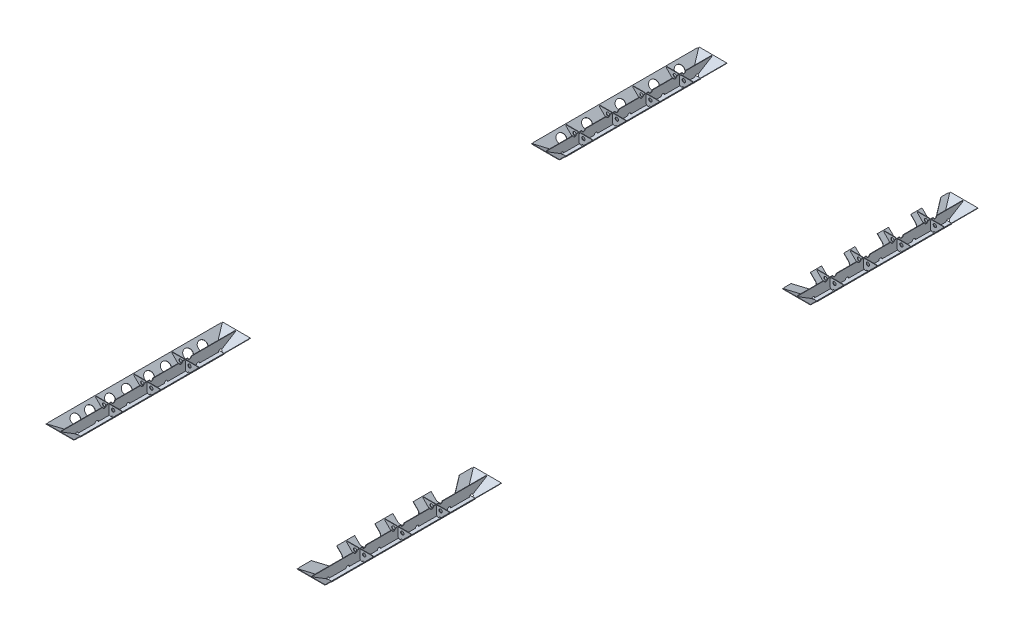
from build123d import *

# Parameters (mm, degrees)
EXTRUDE_1_DEPTH        = 3815
EXTRUDE_1_DEPTH_BACK   = 2635
EXTRUDE_1_2_DEPTH      = 3815
EXTRUDE_1_2_DEPTH_BACK = 2635
CUT_EXTRUDE_1_DEPTH    = 4017.351686101
EXTRUDE_2_DEPTH        = 3
EXTRUDE_3_DEPTH        = 3
EXTRUDE_4_DEPTH        = 3
EXTRUDE_5_DEPTH        = 3
SKETCH_9_W             = 70
SKETCH_9_H             = 1206.908239056
EXTRUDE_6_DEPTH        = 8
SKETCH_9_H_2           = 1286.908239056
EXTRUDE_6_2_DEPTH      = 8
CHAMFER_1_SIZE         = 10
CHAMFER_1_SIZE_2       = 7.139641905
CHAMFER_2_SIZE         = 10
CHAMFER_2_SIZE_2       = 7.139641905
CHAMFER_3_SIZE         = 10
CHAMFER_3_SIZE_2       = 7.139641905
CHAMFER_4_SIZE         = 10
CHAMFER_4_SIZE_2       = 7.139641905
EXTRUDE_7_DEPTH        = 2
EXTRUDE_7_DEPTH_BACK   = 2
EXTRUDE_8_DEPTH        = 2
EXTRUDE_8_DEPTH_BACK   = 2
EXTRUDE_START          = -2039
EXTRUDE_9_OUTLINE_R    = 15
EXTRUDE_9_DEPTH        = 4
PATTERN_LINEAR_1_COUNT = 4
PATTERN_LINEAR_1_PITCH = 300
SKETCH_14_R            = 15
EXTRUDE_10_DEPTH       = 4
PATTERN_LINEAR_2_COUNT = 2
PATTERN_LINEAR_2_PITCH = 343
PATTERN_LINEAR_3_COUNT = 2
PATTERN_LINEAR_3_PITCH = 342
SKETCH_15_R            = 40
CUT_EXTRUDE_2_DEPTH    = 3626.799052034
SKETCH_16_R            = 40
CUT_EXTRUDE_3_DEPTH    = 3626.799052034
CUT_EXTRUDE_4_DEPTH    = 3647.131196916
CUT_EXTRUDE_5_DEPTH    = 3647.131196916
CUT_EXTRUDE_6_DEPTH    = 3647.131196916
CUT_EXTRUDE_7_DEPTH    = 3647.131196916
CUT_EXTRUDE_8_DEPTH    = 4467.849280283
CUT_EXTRUDE_9_DEPTH    = 3974.987784466
CUT_EXTRUDE_10_DEPTH   = 3381.10603862
CUT_EXTRUDE_11_DEPTH   = 3865.510804019


# Read off the part's stored shape, not the designer's step: Бобышка-Вытянуть9
with BuildPart() as part:
    # Эскиз3 → Бобышка-Вытянуть1 (new, two sides: drawn at the far end of the back side and taken through both)
    with BuildSketch(Plane.XY.offset(-EXTRUDE_1_DEPTH_BACK)):
        Polygon((1000, -3), (1090, -93), (1087.878679656, -95.121320344), (997.878679656, -5.121320344), align=None)
    extrude(amount=EXTRUDE_1_DEPTH + EXTRUDE_1_DEPTH_BACK)


with BuildPart() as body_2:
    # Эскиз3 → Extrude 1 2 (new, two sides: drawn at the far end of the back side and taken through both)
    with BuildSketch(Plane.XY.offset(-EXTRUDE_1_2_DEPTH_BACK)):
        Polygon((1252.121320344, -5.121320344), (1162.121320344, -95.121320344), (1160, -93), (1250, -3), align=None)
    extrude(amount=EXTRUDE_1_2_DEPTH + EXTRUDE_1_2_DEPTH_BACK)


with BuildPart() as cut_extrude_1_tool:
    # Эскиз4 → Вырез-Вытянуть1 (new, through all)
    with BuildSketch(Plane(origin=(0, 0, 0), x_dir=(0, 0, -1), z_dir=(1, 0, 0))):
        Polygon((2335, -3), (2185, -95.121320344), (2635, -95.121320344), (2635, -3), align=None)
        Polygon((835, -3), (985, -95.121320344), (-2085, -95.121320344), (-1935, -3), align=None)
        Polygon((-3515, -3), (-3365, -95.121320344), (-3815, -95.121320344), (-3815, -3), align=None)
    extrude(amount=CUT_EXTRUDE_1_DEPTH)


with BuildPart() as part_1:
    add(part.part)

    # Вырез-Вытянуть1: cut by cut_extrude_1_tool
    add(cut_extrude_1_tool.part, mode=Mode.SUBTRACT)


with BuildPart() as body_2_1:
    add(body_2.part)

    # Вырез-Вытянуть1: cut by cut_extrude_1_tool
    add(cut_extrude_1_tool.part, mode=Mode.SUBTRACT)


with BuildPart() as cut_extrude_1_piece_1:
    # of the separate pieces the step leaves, piece 1, a body of its own (cut_extrude_1_pieces)
    add(part_1.part.solids().sort_by_distance((1000, -3, 1935))[0])

    # Фаска3
    # the kernel refuses this chamfer: 10, 7.139641905 mm, written as the material it takes off along each edge
    with BuildSketch(Plane(origin=(985.954478201, -17.045521799, 1957.870148431), x_dir=(0.5142163704539047, 0.5531014120676607, 0.655484822346004), z_dir=(0.4636730697913419, 0.4636730697928468, -0.754993091822138)), Plane(origin=(1011.924201456, 8.924201456, 3534.416028903), x_dir=(0.5142163704539051, 0.5531014120676603, -0.6554848223460039), z_dir=(-0.4636730697913419, -0.4636730697928468, -0.754993091822138))) as chamfer_3_piece_1:
        Polygon((CHAMFER_3_SIZE * 0.999621916911, CHAMFER_3_SIZE * 0.0274958766106), (CHAMFER_3_SIZE_2 * 0.580375479183, CHAMFER_3_SIZE_2 * 0.814349005757), (0, 0), align=None)
    extrude(amount=56.008694373, mode=Mode.SUBTRACT)

    # Эскиз19 → Вырез-Вытянуть6 (cut, through all)
    with BuildSketch(Plane(origin=(496.378679656, 496.378679656, 0), x_dir=(0, 0, 1), z_dir=(-0.7071067811865474, -0.7071067811865477, 0))):
        with BuildLine():
            Line((3353.454119528, -836.507322144), (3368.454119528, -836.507322144))
            Line((3368.454119528, -836.507322144), (3379.779015905, -826.671330987))
            ThreePointArc((3379.779015905, -826.671330987), (3363.204045512, -822.456104302), (3353.454119528, -836.507322144))
        make_face()
        with BuildLine():
            Line((2096.545880472, -836.507322144), (2081.545880472, -836.507322144))
            Line((2081.545880472, -836.507322144), (2070.220984095, -826.671330987))
            ThreePointArc((2070.220984095, -826.671330987), (2086.795954488, -822.456104302), (2096.545880472, -836.507322144))
        make_face()
        with BuildLine():
            Line((3091, -836.507322144), (3121, -836.507322144))
            ThreePointArc((3121, -836.507322144), (3106, -821.507322144), (3091, -836.507322144))
        make_face()
        with BuildLine():
            Line((3031, -836.507322144), (3061, -836.507322144))
            ThreePointArc((3061, -836.507322144), (3046, -821.507322144), (3031, -836.507322144))
        make_face()
        with BuildLine():
            Line((2689, -836.507322144), (2719, -836.507322144))
            ThreePointArc((2719, -836.507322144), (2704, -821.507322144), (2689, -836.507322144))
        make_face()
        with BuildLine():
            Line((2749, -836.507322144), (2779, -836.507322144))
            ThreePointArc((2779, -836.507322144), (2764, -821.507322144), (2749, -836.507322144))
        make_face()
        with BuildLine():
            Line((2406, -836.507322144), (2436, -836.507322144))
            ThreePointArc((2436, -836.507322144), (2421, -821.507322144), (2406, -836.507322144))
        make_face()
        with BuildLine():
            Line((2346, -836.507322144), (2376, -836.507322144))
            ThreePointArc((2376, -836.507322144), (2361, -821.507322144), (2346, -836.507322144))
        make_face()
    extrude(amount=-CUT_EXTRUDE_6_DEPTH, mode=Mode.SUBTRACT)

    # Эскиз20 → Вырез-Вытянуть7 (cut, through all)
    with BuildSketch(Plane(origin=(496.378679656, 496.378679656, 0), x_dir=(0, 0, 1), z_dir=(-0.7071067811865474, -0.7071067811865477, 0))):
        with BuildLine():
            Line((2060.455042549, -709.22810153), (2164.308584866, -799.427825203))
            ThreePointArc((2164.308584866, -799.427825203), (2176.537697243, -806.698015774), (2190.537894618, -809.22810153))
            Line((2190.537894618, -809.22810153), (2275, -809.22810153))
            ThreePointArc((2275, -809.22810153), (2303.284271247, -797.512372778), (2315, -769.22810153))
            Line((2315, -769.22810153), (2315, -709.22810153))
            Line((2315, -709.22810153), (2060.455042549, -709.22810153))
        make_face()
        with BuildLine():
            Line((3160, -709.22810153), (3160, -769.22810153))
            ThreePointArc((3160, -769.22810153), (3171.715728753, -797.512372778), (3200, -809.22810153))
            Line((3200, -809.22810153), (3259.462105382, -809.22810153))
            ThreePointArc((3259.462105382, -809.22810153), (3273.462302757, -806.698015774), (3285.691415134, -799.427825203))
            Line((3285.691415134, -799.427825203), (3389.544957451, -709.22810153))
            Line((3389.544957451, -709.22810153), (3160, -709.22810153))
        make_face()
        with BuildLine():
            Line((2475, -709.22810153), (2658, -709.22810153))
            Line((2658, -709.22810153), (2658, -769.22810153))
            ThreePointArc((2658, -769.22810153), (2646.284271247, -797.512372778), (2618, -809.22810153))
            Line((2618, -809.22810153), (2515, -809.22810153))
            ThreePointArc((2515, -809.22810153), (2486.715728753, -797.512372778), (2475, -769.22810153))
            Line((2475, -769.22810153), (2475, -709.22810153))
        make_face()
        with BuildLine():
            Line((2818, -709.22810153), (3000, -709.22810153))
            Line((3000, -709.22810153), (3000, -769.22810153))
            ThreePointArc((3000, -769.22810153), (2988.284271247, -797.512372778), (2960, -809.22810153))
            Line((2960, -809.22810153), (2858, -809.22810153))
            ThreePointArc((2858, -809.22810153), (2829.715728753, -797.512372778), (2818, -769.22810153))
            Line((2818, -769.22810153), (2818, -709.22810153))
        make_face()
    extrude(amount=-CUT_EXTRUDE_7_DEPTH, mode=Mode.SUBTRACT)


with BuildPart() as cut_extrude_1_piece_2:
    # of the separate pieces the step leaves, piece 2, a body of its own (cut_extrude_1_pieces)
    add(part_1.part.solids().sort_by_distance((1000, -3, -2335))[0])

    # Фаска1
    # the kernel refuses this chamfer: 10, 7.139641905 mm, written as the material it takes off along each edge
    with BuildSketch(Plane(origin=(1011.924201456, 8.924201456, -815.583971097), x_dir=(0.514216370453908, 0.5531014120676567, -0.6554848223460048), z_dir=(-0.4636730697913424, -0.46367306979284734, -0.7549930918221375))) as chamfer_1_piece_1:
        Polygon((CHAMFER_1_SIZE * 0.999621916911, CHAMFER_1_SIZE * 0.0274958766106), (CHAMFER_1_SIZE_2 * 0.580375479183, CHAMFER_1_SIZE_2 * 0.814349005757), (0, 0), align=None)
    extrude(amount=56.008694373, mode=Mode.SUBTRACT)
    with BuildSketch(Plane(origin=(1011.924201456, 8.924201456, -2354.416028903), x_dir=(0.5142163704539046, 0.5531014120676621, 0.6554848223460031), z_dir=(-0.4636730697913412, -0.46367306979284617, 0.7549930918221388))) as chamfer_1_piece_2:
        Polygon((CHAMFER_1_SIZE * 0.999621916911, -CHAMFER_1_SIZE * 0.0274958766106), (CHAMFER_1_SIZE_2 * 0.580375479183, -CHAMFER_1_SIZE_2 * 0.814349005757), (0, 0), align=None)
    extrude(amount=56.008694373, mode=Mode.SUBTRACT)

    # Эскиз17 → Вырез-Вытянуть4 (cut, through all)
    with BuildSketch(Plane(origin=(496.378679656, 496.378679656, 0), x_dir=(0, 0, 1), z_dir=(-0.7071067811865474, -0.7071067811865477, 0))):
        with BuildLine():
            Line((-996.545880472, -836.507322144), (-981.545880472, -836.507322144))
            Line((-981.545880472, -836.507322144), (-970.220984095, -826.671330987))
            ThreePointArc((-970.220984095, -826.671330987), (-986.795954488, -822.456104302), (-996.545880472, -836.507322144))
        make_face()
        with BuildLine():
            Line((-2173.454119528, -836.507322144), (-2188.454119528, -836.507322144))
            Line((-2188.454119528, -836.507322144), (-2199.779015905, -826.671330987))
            ThreePointArc((-2199.779015905, -826.671330987), (-2183.204045512, -822.456104302), (-2173.454119528, -836.507322144))
        make_face()
        with BuildLine():
            Line((-1124, -836.507322144), (-1094, -836.507322144))
            ThreePointArc((-1094, -836.507322144), (-1109, -821.507322144), (-1124, -836.507322144))
        make_face()
        with BuildLine():
            Line((-1184, -836.507322144), (-1154, -836.507322144))
            ThreePointArc((-1154, -836.507322144), (-1169, -821.507322144), (-1184, -836.507322144))
        make_face()
        with BuildLine():
            Line((-1484, -836.507322144), (-1454, -836.507322144))
            ThreePointArc((-1454, -836.507322144), (-1469, -821.507322144), (-1484, -836.507322144))
        make_face()
        with BuildLine():
            Line((-1424, -836.507322144), (-1394, -836.507322144))
            ThreePointArc((-1394, -836.507322144), (-1409, -821.507322144), (-1424, -836.507322144))
        make_face()
        with BuildLine():
            Line((-1724, -836.507322144), (-1694, -836.507322144))
            ThreePointArc((-1694, -836.507322144), (-1709, -821.507322144), (-1724, -836.507322144))
        make_face()
        with BuildLine():
            Line((-1784, -836.507322144), (-1754, -836.507322144))
            ThreePointArc((-1754, -836.507322144), (-1769, -821.507322144), (-1784, -836.507322144))
        make_face()
        with BuildLine():
            Line((-2024, -836.507322144), (-1994, -836.507322144))
            ThreePointArc((-1994, -836.507322144), (-2009, -821.507322144), (-2024, -836.507322144))
        make_face()
        with BuildLine():
            Line((-2084, -836.507322144), (-2054, -836.507322144))
            ThreePointArc((-2054, -836.507322144), (-2069, -821.507322144), (-2084, -836.507322144))
        make_face()
    extrude(amount=-CUT_EXTRUDE_4_DEPTH, mode=Mode.SUBTRACT)

    # Эскиз18 → Вырез-Вытянуть5 (cut, through all)
    with BuildSketch(Plane(origin=(496.378679656, 496.378679656, 0), x_dir=(0, 0, 1), z_dir=(-0.7071067811865474, -0.7071067811865477, 0))):
        with BuildLine():
            Line((-911.250576888, -709.22810153), (-1018.770690248, -802.612345322))
            ThreePointArc((-1018.770690248, -802.612345322), (-1061.595595951, -808.807486603), (-1085, -772.412621649))
            Line((-1085, -772.412621649), (-1085, -709.22810153))
            Line((-1085, -709.22810153), (-911.250576888, -709.22810153))
        make_face()
        with BuildLine():
            Line((-1385, -709.22810153), (-1185, -709.22810153))
            Line((-1185, -709.22810153), (-1185, -769.22810153))
            ThreePointArc((-1185, -769.22810153), (-1196.715728753, -797.512372778), (-1225, -809.22810153))
            Line((-1225, -809.22810153), (-1345, -809.22810153))
            ThreePointArc((-1345, -809.22810153), (-1373.284271247, -797.512372778), (-1385, -769.22810153))
            Line((-1385, -769.22810153), (-1385, -709.22810153))
        make_face()
        with BuildLine():
            Line((-1685, -709.22810153), (-1485, -709.22810153))
            Line((-1485, -709.22810153), (-1485, -769.22810153))
            ThreePointArc((-1485, -769.22810153), (-1496.715728753, -797.512372778), (-1525, -809.22810153))
            Line((-1525, -809.22810153), (-1645, -809.22810153))
            ThreePointArc((-1645, -809.22810153), (-1673.284271247, -797.512372778), (-1685, -769.22810153))
            Line((-1685, -769.22810153), (-1685, -709.22810153))
        make_face()
        with BuildLine():
            Line((-1985, -709.22810153), (-1785, -709.22810153))
            Line((-1785, -709.22810153), (-1785, -769.22810153))
            ThreePointArc((-1785, -769.22810153), (-1796.715728753, -797.512372778), (-1825, -809.22810153))
            Line((-1825, -809.22810153), (-1945, -809.22810153))
            ThreePointArc((-1945, -809.22810153), (-1973.284271247, -797.512372778), (-1985, -769.22810153))
            Line((-1985, -769.22810153), (-1985, -709.22810153))
        make_face()
        with BuildLine():
            Line((-2085, -709.22810153), (-2085, -769.412621649))
            ThreePointArc((-2085, -769.412621649), (-2108.404404049, -805.807486603), (-2151.229309752, -799.612345322))
            Line((-2151.229309752, -799.612345322), (-2255.295303584, -709.22810153))
            Line((-2255.295303584, -709.22810153), (-2085, -709.22810153))
        make_face()
    extrude(amount=-CUT_EXTRUDE_5_DEPTH, mode=Mode.SUBTRACT)


with BuildPart() as cut_extrude_1_piece_1_of_body_2:
    # of the separate pieces the step leaves, piece 1, a body of its own (cut_extrude_1_pieces_of_body_2)
    add(body_2_1.part.solids().sort_by_distance((1252.121320344, -5.121320344, 1938.454119528))[0])

    # Фаска4
    # the kernel refuses this chamfer: 10, 7.139641905 mm, written as the material it takes off along each edge
    with BuildSketch(Plane(origin=(1238.075798544, 8.924201456, 1915.583971097), x_dir=(-0.5142163704539027, 0.5531014120676626, 0.6554848223460039), z_dir=(0.4636730697913419, -0.4636730697928468, 0.754993091822138)), Plane(origin=(1264.045521799, -17.045521799, 3492.129851569), x_dir=(-0.5142163704539026, 0.5531014120676628, -0.6554848223460039), z_dir=(-0.4636730697913419, 0.4636730697928468, 0.754993091822138))) as chamfer_4_piece_1:
        Polygon((CHAMFER_4_SIZE * 0.999621916911, CHAMFER_4_SIZE * 0.0274958766106), (CHAMFER_4_SIZE_2 * 0.580375479183, CHAMFER_4_SIZE_2 * 0.814349005757), (0, 0), align=None)
    extrude(amount=56.008694373, mode=Mode.SUBTRACT)

    # Эскиз16 → Вырез-Вытянуть3 (cut, through all)
    with BuildSketch(Plane(origin=(628.621320344, -628.621320344, 0), x_dir=(0, 0, -1), z_dir=(0.7071067811865474, -0.7071067811865477, 0))):
        with Locations(Location((-2160, 814.482935526, 0), (0, 0, 90))):
            Circle(SKETCH_16_R)
        with Locations(Location((-2290, 814.482935526, 0), (0, 0, 90))):
            Circle(SKETCH_16_R)
        with Locations(Location((-2490, 814.482935526, 0), (0, 0, 90))):
            Circle(SKETCH_16_R)
        with Locations(Location((-2640, 814.482935526, 0), (0, 0, 90))):
            Circle(SKETCH_16_R)
        with Locations(Location((-2840, 814.482935526, 0), (0, 0, 90))):
            Circle(SKETCH_16_R)
        with Locations(Location((-2990, 814.482935526, 0), (0, 0, 90))):
            Circle(SKETCH_16_R)
        with Locations(Location((-3170, 814.482935526, 0), (0, 0, 90))):
            Circle(SKETCH_16_R)
        with Locations(Location((-3300, 814.482935526, 0), (0, 0, 90))):
            Circle(SKETCH_16_R)
        with BuildLine():
            Line((-2096.545880472, 754.482935526), (-2081.545880472, 754.482935526))
            Line((-2081.545880472, 754.482935526), (-2070.220984095, 764.318926683))
            ThreePointArc((-2070.220984095, 764.318926683), (-2086.795954488, 768.534153368), (-2096.545880472, 754.482935526))
        make_face()
        with BuildLine():
            Line((-3353.454119528, 754.482935526), (-3368.454119528, 754.482935526))
            Line((-3368.454119528, 754.482935526), (-3379.779015905, 764.318926683))
            ThreePointArc((-3379.779015905, 764.318926683), (-3363.204045512, 768.534153368), (-3353.454119528, 754.482935526))
        make_face()
        with BuildLine():
            Line((-2380, 754.482935526), (-2350, 754.482935526))
            ThreePointArc((-2350, 754.482935526), (-2365, 769.482935526), (-2380, 754.482935526))
        make_face()
        with BuildLine():
            Line((-2410, 754.482935526), (-2440, 754.482935526))
            ThreePointArc((-2440, 754.482935526), (-2425, 769.482935526), (-2410, 754.482935526))
        make_face()
        with BuildLine():
            Line((-2723, 754.482935526), (-2693, 754.482935526))
            ThreePointArc((-2693, 754.482935526), (-2708, 769.482935526), (-2723, 754.482935526))
        make_face()
        with BuildLine():
            Line((-2753, 754.482935526), (-2783, 754.482935526))
            ThreePointArc((-2783, 754.482935526), (-2768, 769.482935526), (-2753, 754.482935526))
        make_face()
        with BuildLine():
            Line((-3065, 754.482935526), (-3035, 754.482935526))
            ThreePointArc((-3035, 754.482935526), (-3050, 769.482935526), (-3065, 754.482935526))
        make_face()
        with BuildLine():
            Line((-3095, 754.482935526), (-3125, 754.482935526))
            ThreePointArc((-3125, 754.482935526), (-3110, 769.482935526), (-3095, 754.482935526))
        make_face()
    extrude(amount=-CUT_EXTRUDE_3_DEPTH, mode=Mode.SUBTRACT)


with BuildPart() as cut_extrude_1_piece_2_of_body_2:
    # of the separate pieces the step leaves, piece 2, a body of its own (cut_extrude_1_pieces_of_body_2)
    add(body_2_1.part.solids().sort_by_distance((1252.121320344, -5.121320344, -2331.545880472))[0])

    # Фаска2
    # the kernel refuses this chamfer: 10, 7.139641905 mm, written as the material it takes off along each edge
    with BuildSketch(Plane(origin=(1264.045521799, -17.045521799, -857.870148431), x_dir=(-0.5142163704539056, 0.5531014120676591, -0.6554848223460047), z_dir=(-0.4636730697913424, 0.46367306979284734, 0.7549930918221375))) as chamfer_2_piece_1:
        Polygon((CHAMFER_2_SIZE * 0.999621916911, CHAMFER_2_SIZE * 0.0274958766106), (CHAMFER_2_SIZE_2 * 0.580375479183, CHAMFER_2_SIZE_2 * 0.814349005757), (0, 0), align=None)
    extrude(amount=56.008694373, mode=Mode.SUBTRACT)
    with BuildSketch(Plane(origin=(1264.045521799, -17.045521799, -2312.129851569), x_dir=(-0.5142163704539028, 0.5531014120676637, 0.655484822346003), z_dir=(-0.4636730697913412, 0.46367306979284617, -0.7549930918221388))) as chamfer_2_piece_2:
        Polygon((CHAMFER_2_SIZE * 0.999621916911, -CHAMFER_2_SIZE * 0.0274958766106), (CHAMFER_2_SIZE_2 * 0.580375479183, -CHAMFER_2_SIZE_2 * 0.814349005757), (0, 0), align=None)
    extrude(amount=56.008694373, mode=Mode.SUBTRACT)

    # Эскиз15 → Вырез-Вытянуть2 (cut, through all)
    with BuildSketch(Plane(origin=(628.621320344, -628.621320344, 0), x_dir=(0, 0, -1), z_dir=(0.7071067811865474, -0.7071067811865477, 0))):
        with Locations(Location((2115, 814.482935526, 0), (0, 0, 90))):
            Circle(SKETCH_15_R)
        with Locations(Location((1885, 814.482935526, 0), (0, 0, 90))):
            Circle(SKETCH_15_R)
        with Locations(Location((1585, 814.482935526, 0), (0, 0, 90))):
            Circle(SKETCH_15_R)
        with Locations(Location((1285, 814.482935526, 0), (0, 0, 90))):
            Circle(SKETCH_15_R)
        with Locations(Location((1055, 814.482935526, 0), (0, 0, 90))):
            Circle(SKETCH_15_R)
        with BuildLine():
            Line((2173.454119528, 754.482935526), (2188.454119528, 754.482935526))
            Line((2188.454119528, 754.482935526), (2199.779015905, 764.318926683))
            ThreePointArc((2199.779015905, 764.318926683), (2183.204045512, 768.534153368), (2173.454119528, 754.482935526))
        make_face()
        with BuildLine():
            Line((2050, 754.482935526), (2080, 754.482935526))
            ThreePointArc((2080, 754.482935526), (2065, 769.482935526), (2050, 754.482935526))
        make_face()
        with BuildLine():
            Line((1990, 754.482935526), (2020, 754.482935526))
            ThreePointArc((2020, 754.482935526), (2005, 769.482935526), (1990, 754.482935526))
        make_face()
        with BuildLine():
            Line((1750, 754.482935526), (1780, 754.482935526))
            ThreePointArc((1780, 754.482935526), (1765, 769.482935526), (1750, 754.482935526))
        make_face()
        with BuildLine():
            Line((1690, 754.482935526), (1720, 754.482935526))
            ThreePointArc((1720, 754.482935526), (1705, 769.482935526), (1690, 754.482935526))
        make_face()
        with BuildLine():
            Line((1450, 754.482935526), (1480, 754.482935526))
            ThreePointArc((1480, 754.482935526), (1465, 769.482935526), (1450, 754.482935526))
        make_face()
        with BuildLine():
            Line((1390, 754.482935526), (1420, 754.482935526))
            ThreePointArc((1420, 754.482935526), (1405, 769.482935526), (1390, 754.482935526))
        make_face()
        with BuildLine():
            Line((1150, 754.482935526), (1180, 754.482935526))
            ThreePointArc((1180, 754.482935526), (1165, 769.482935526), (1150, 754.482935526))
        make_face()
        with BuildLine():
            Line((1090, 754.482935526), (1120, 754.482935526))
            ThreePointArc((1120, 754.482935526), (1105, 769.482935526), (1090, 754.482935526))
        make_face()
        with BuildLine():
            Line((996.545880472, 754.482935526), (981.545880472, 754.482935526))
            Line((981.545880472, 754.482935526), (970.220984095, 764.318926683))
            ThreePointArc((970.220984095, 764.318926683), (986.795954488, 768.534153368), (996.545880472, 754.482935526))
        make_face()
    extrude(amount=-CUT_EXTRUDE_2_DEPTH, mode=Mode.SUBTRACT)


with BuildPart() as body_5:
    # Эскиз5 → Бобышка-Вытянуть2 (new body)
    with BuildSketch(Plane(origin=(0, -1043.459630602, -640.832525975), x_dir=(1, 0, 0), z_dir=(0, 0.8521305478013935, 0.5233292744570068))):
        Polygon((1000, 1988.154841293), (1090, 1816.178985187), (1160, 1816.178985187), (1250, 1988.154841293), align=None)
    extrude(amount=-EXTRUDE_2_DEPTH)

    # Эскиз21 → Вырез-Вытянуть8 (cut, through all)
    with BuildSketch(Plane(origin=(0, -1046.016022245, -642.402513798), x_dir=(1, 0, 0), z_dir=(0, -0.8521305478013941, -0.5233292744570057))):
        with BuildLine():
            Line((1140, -1816.178985187), (1110, -1816.178985187))
            ThreePointArc((1110, -1816.178985187), (1125, -1831.178985187), (1140, -1816.178985187))
        make_face()
    extrude(amount=-CUT_EXTRUDE_8_DEPTH, mode=Mode.SUBTRACT)


with BuildPart() as body_6:
    # Эскиз6 → Бобышка-Вытянуть3 (new body)
    with BuildSketch(Plane(origin=(0, 370.185579794, -227.346562552), x_dir=(-1, 0, 0), z_dir=(1.9592936018679194e-15, -0.8521305478013921, 0.5233292744570088))):
        Polygon((-1090, 885.074851343), (-1000, 713.098995238), (-1250, 713.098995238), (-1160, 885.074851343), align=None)
    extrude(amount=EXTRUDE_3_DEPTH)

    # Эскиз22 → Вырез-Вытянуть9 (cut, through all)
    with BuildSketch(Plane(origin=(0, 367.62918815, -225.776574728), x_dir=(1, 0, 0), z_dir=(1.7774307300035333e-15, -0.852130547801392, 0.5233292744570092))):
        with BuildLine():
            Line((1110, -885.074851343), (1140, -885.074851343))
            ThreePointArc((1140, -885.074851343), (1125, -870.074851343), (1110, -885.074851343))
        make_face()
    extrude(amount=-CUT_EXTRUDE_9_DEPTH, mode=Mode.SUBTRACT)


with BuildPart() as body_7:
    # Эскиз7 → Бобышка-Вытянуть4 (new body)
    with BuildSketch(Plane(origin=(0, 860.72492725, 528.607445006), x_dir=(1, 0, 0), z_dir=(0, 0.8521305478013936, 0.5233292744570065))):
        Polygon((1000, -1650.442597819), (1090, -1822.418453925), (1160, -1822.418453925), (1250, -1650.442597819), align=None)
    extrude(amount=-EXTRUDE_4_DEPTH)

    # Эскиз23 → Вырез-Вытянуть10 (cut, through all)
    with BuildSketch(Plane(origin=(0, 858.168535606, 527.037457182), x_dir=(1, 0, 0), z_dir=(0, -0.8521305478013933, -0.523329274457007))):
        with BuildLine():
            Line((1110, 1822.418453925), (1140, 1822.418453925))
            ThreePointArc((1140, 1822.418453925), (1125, 1807.418453925), (1110, 1822.418453925))
        make_face()
    extrude(amount=-CUT_EXTRUDE_10_DEPTH, mode=Mode.SUBTRACT)


with BuildPart() as body_8:
    # Эскиз8 → Бобышка-Вытянуть5 (new body)
    with BuildSketch(Plane(origin=(0, -1569.674566964, 964.003290789), x_dir=(-1, 0, 0), z_dir=(0, -0.8521305478013931, 0.5233292744570075))):
        Polygon((-1090, -2821.693031593), (-1000, -2993.668887699), (-1250, -2993.668887699), (-1160, -2821.693031593), align=None)
    extrude(amount=EXTRUDE_5_DEPTH)

    # Эскиз24 → Вырез-Вытянуть11 (cut, through all)
    with BuildSketch(Plane(origin=(0, -1572.230958607, 965.573278613), x_dir=(1, 0, 0), z_dir=(0, -0.8521305478013932, 0.5233292744570073))):
        with BuildLine():
            Line((1110, 2821.693031593), (1140, 2821.693031593))
            ThreePointArc((1140, 2821.693031593), (1125, 2836.693031593), (1110, 2821.693031593))
        make_face()
    extrude(amount=-CUT_EXTRUDE_11_DEPTH, mode=Mode.SUBTRACT)


with BuildPart() as body_9:
    # Эскиз9 → Бобышка-Вытянуть6 (new body)
    with BuildSketch(Plane(origin=(0, -93, 0), x_dir=(1, 0, 0), z_dir=(0, 1, 0))):
        with Locations((1125, 1585)):
            Rectangle(SKETCH_9_W, SKETCH_9_H)
    extrude(amount=-EXTRUDE_6_DEPTH)


with BuildPart() as body_10:
    # Эскиз9 → Extrude 6 2 (new body)
    with BuildSketch(Plane(origin=(0, -93, 0), x_dir=(1, 0, 0), z_dir=(0, 1, 0))):
        with Locations((1125, -2725)):
            Rectangle(SKETCH_9_W, SKETCH_9_H_2)
    extrude(amount=-EXTRUDE_6_2_DEPTH)


with BuildPart() as body_11:
    # Эскиз10 → Бобышка-Вытянуть7 (new, two sides: drawn at the far end of the back side and taken through both)
    with BuildSketch(Plane(origin=(1125, 0, 0), x_dir=(0, 0, -1), z_dir=(1, 0, 0)).offset(-EXTRUDE_7_DEPTH_BACK)):
        with BuildLine():
            Line((2173.454119528, -93), (1900, -93))
            ThreePointArc((1900, -93), (1885, -78), (1870, -93))
            Line((1870, -93), (1600, -93))
            ThreePointArc((1600, -93), (1585, -78), (1570, -93))
            Line((1570, -93), (1300, -93))
            ThreePointArc((1300, -93), (1285, -78), (1270, -93))
            Line((1270, -93), (996.545880472, -93))
            ThreePointArc((996.545880472, -93), (985.62452159, -78.565157201), (968.763922255, -85.150060883))
            Line((968.763922255, -85.150060883), (843.521305478, -8.233292745))
            Line((843.521305478, -8.233292745), (845, -3))
            Line((845, -3), (1080, -3))
            ThreePointArc((1080, -3), (1095, -18), (1110, -3))
            Line((1110, -3), (1160, -3))
            ThreePointArc((1160, -3), (1175, -18), (1190, -3))
            Line((1190, -3), (1380, -3))
            ThreePointArc((1380, -3), (1395, -18), (1410, -3))
            Line((1410, -3), (1460, -3))
            ThreePointArc((1460, -3), (1475, -18), (1490, -3))
            Line((1490, -3), (1680, -3))
            ThreePointArc((1680, -3), (1695, -18), (1710, -3))
            Line((1710, -3), (1760, -3))
            ThreePointArc((1760, -3), (1775, -18), (1790, -3))
            Line((1790, -3), (1980, -3))
            ThreePointArc((1980, -3), (1995, -18), (2010, -3))
            Line((2010, -3), (2060, -3))
            ThreePointArc((2060, -3), (2075, -18), (2090, -3))
            Line((2090, -3), (2325, -3))
            Line((2325, -3), (2326.478694522, -8.233292745))
            Line((2326.478694522, -8.233292745), (2201.236077745, -85.150060883))
            ThreePointArc((2201.236077745, -85.150060883), (2184.37547841, -78.565157201), (2173.454119528, -93))
        make_face()
    extrude(amount=EXTRUDE_7_DEPTH + EXTRUDE_7_DEPTH_BACK)


with BuildPart() as body_12:
    # Эскиз11 → Бобышка-Вытянуть8 (new, two sides: drawn at the far end of the back side and taken through both)
    with BuildSketch(Plane(origin=(1125, 0, 0), x_dir=(0, 0, -1), z_dir=(1, 0, 0)).offset(-EXTRUDE_8_DEPTH_BACK)):
        with BuildLine():
            Line((-2068.763922255, -85.150060883), (-1943.521305478, -8.233292745))
            Line((-1943.521305478, -8.233292745), (-1945, -3))
            Line((-1945, -3), (-2340, -3))
            ThreePointArc((-2340, -3), (-2355, -18), (-2370, -3))
            Line((-2370, -3), (-2420, -3))
            ThreePointArc((-2420, -3), (-2435, -18), (-2450, -3))
            Line((-2450, -3), (-2683, -3))
            ThreePointArc((-2683, -3), (-2698, -18), (-2713, -3))
            Line((-2713, -3), (-2763, -3))
            ThreePointArc((-2763, -3), (-2778, -18), (-2793, -3))
            Line((-2793, -3), (-3025, -3))
            ThreePointArc((-3025, -3), (-3040, -18), (-3055, -3))
            Line((-3055, -3), (-3105, -3))
            ThreePointArc((-3105, -3), (-3120, -18), (-3135, -3))
            Line((-3135, -3), (-3505, -3))
            Line((-3505, -3), (-3506.478694522, -8.233292745))
            Line((-3506.478694522, -8.233292745), (-3381.236077745, -85.150060883))
            ThreePointArc((-3381.236077745, -85.150060883), (-3364.37547841, -78.565157201), (-3353.454119528, -93))
            Line((-3353.454119528, -93), (-3203.5, -93))
            ThreePointArc((-3203.5, -93), (-3188.5, -78), (-3173.5, -93))
            Line((-3173.5, -93), (-2924, -93))
            ThreePointArc((-2924, -93), (-2909, -78), (-2894, -93))
            Line((-2894, -93), (-2581.5, -93))
            ThreePointArc((-2581.5, -93), (-2566.5, -78), (-2551.5, -93))
            Line((-2551.5, -93), (-2295, -93))
            ThreePointArc((-2295, -93), (-2280, -78), (-2265, -93))
            Line((-2265, -93), (-2096.545880472, -93))
            ThreePointArc((-2096.545880472, -93), (-2085.62452159, -78.565157201), (-2068.763922255, -85.150060883))
        make_face()
    extrude(amount=EXTRUDE_8_DEPTH + EXTRUDE_8_DEPTH_BACK)


with BuildPart() as body_13:
    # Бобышка-Вытянуть9 outline → Бобышка-Вытянуть9 (new body)
    with BuildSketch(Plane.XY.offset(EXTRUDE_START)):
        with BuildLine():
            Line((1123, -83), (1123, -13))
            Line((1123, -13), (1113, -3))
            Line((1113, -3), (1010, -3))
            Line((1010, -3), (1007.071067812, -10.071067812))
            Line((1007.071067812, -10.071067812), (1082.928932188, -85.928932188))
            ThreePointArc((1082.928932188, -85.928932188), (1093.826834324, -83.761204675), (1100, -93))
            Line((1100, -93), (1113, -93))
            Line((1113, -93), (1123, -83))
        make_face()
        with Locations((1085, -33)):
            Circle(EXTRUDE_9_OUTLINE_R, mode=Mode.SUBTRACT)
    extrude(amount=EXTRUDE_9_DEPTH)


with BuildPart() as pattern_linear_1_1:
    # Линейный массив1: pattern copy
    add(body_13.part.moved(Location(Vector(0, 0, 1) * (1 * PATTERN_LINEAR_1_PITCH))))


with BuildPart() as pattern_linear_1_2:
    # Линейный массив1: pattern copy
    add(body_13.part.moved(Location(Vector(0, 0, 1) * (2 * PATTERN_LINEAR_1_PITCH))))


with BuildPart() as pattern_linear_1_3:
    # Линейный массив1: pattern copy
    add(body_13.part.moved(Location(Vector(0, 0, 1) * (3 * PATTERN_LINEAR_1_PITCH))))


with BuildPart() as body_17:
    # Эскиз14 → Бобышка-Вытянуть10 (new body)
    with BuildSketch(Plane.XY.offset(2395)):
        with BuildLine():
            Line((1123, -13), (1123, -83))
            Line((1123, -83), (1113, -93))
            Line((1113, -93), (1100, -93))
            ThreePointArc((1100, -93), (1093.826834324, -83.761204675), (1082.928932188, -85.928932188))
            Line((1082.928932188, -85.928932188), (1007.071067812, -10.071067812))
            Line((1007.071067812, -10.071067812), (1010, -3))
            Line((1010, -3), (1113, -3))
            Line((1113, -3), (1123, -13))
        make_face()
        with Locations((1085, -33)):
            Circle(SKETCH_14_R, mode=Mode.SUBTRACT)
    extrude(amount=-EXTRUDE_10_DEPTH)


with BuildPart() as pattern_linear_2_1:
    # Линейный массив2: pattern copy
    add(body_17.part.moved(Location(Vector(0, 0, 1) * (1 * PATTERN_LINEAR_2_PITCH))))


with BuildPart() as pattern_linear_3_1:
    # Линейный массив3: pattern copy
    add(pattern_linear_2_1.part.moved(Location(Vector(0, 0, 1) * (1 * PATTERN_LINEAR_3_PITCH))))


with BuildPart() as body_20:
    # Зеркальное отражение1: mirrored copy
    add(pattern_linear_3_1.part.mirror(Plane(origin=(1125, 0, 0), x_dir=(0, 0, 1), z_dir=(1, 0, 0))))


with BuildPart() as body_21:
    # Mirror 1 2: mirrored copy
    add(pattern_linear_2_1.part.mirror(Plane(origin=(1125, 0, 0), x_dir=(0, 0, 1), z_dir=(1, 0, 0))))


with BuildPart() as body_22:
    # Mirror 1 3: mirrored copy
    add(body_17.part.mirror(Plane(origin=(1125, 0, 0), x_dir=(0, 0, 1), z_dir=(1, 0, 0))))


with BuildPart() as body_23:
    # Mirror 1 4: mirrored copy
    add(body_13.part.mirror(Plane(origin=(1125, 0, 0), x_dir=(0, 0, 1), z_dir=(1, 0, 0))))


with BuildPart() as body_24:
    # Mirror 1 5: mirrored copy
    add(pattern_linear_1_1.part.mirror(Plane(origin=(1125, 0, 0), x_dir=(0, 0, 1), z_dir=(1, 0, 0))))


with BuildPart() as body_25:
    # Mirror 1 6: mirrored copy
    add(pattern_linear_1_2.part.mirror(Plane(origin=(1125, 0, 0), x_dir=(0, 0, 1), z_dir=(1, 0, 0))))


with BuildPart() as body_26:
    # Mirror 1 7: mirrored copy
    add(pattern_linear_1_3.part.mirror(Plane(origin=(1125, 0, 0), x_dir=(0, 0, 1), z_dir=(1, 0, 0))))


with BuildPart() as body_27:
    # Зеркальное отражение2: mirrored copy
    add(cut_extrude_1_piece_1.part.mirror(Plane(origin=(0, 0, 0), x_dir=(0, 0, 1), z_dir=(1, 0, 0))))


with BuildPart() as body_28:
    # Mirror 2 2: mirrored copy
    add(pattern_linear_2_1.part.mirror(Plane(origin=(0, 0, 0), x_dir=(0, 0, 1), z_dir=(1, 0, 0))))


with BuildPart() as body_29:
    # Mirror 2 3: mirrored copy
    add(body_20.part.mirror(Plane(origin=(0, 0, 0), x_dir=(0, 0, 1), z_dir=(1, 0, 0))))


with BuildPart() as body_30:
    # Mirror 2 4: mirrored copy
    add(body_8.part.mirror(Plane(origin=(0, 0, 0), x_dir=(0, 0, 1), z_dir=(1, 0, 0))))


with BuildPart() as body_31:
    # Mirror 2 5: mirrored copy
    add(body_7.part.mirror(Plane(origin=(0, 0, 0), x_dir=(0, 0, 1), z_dir=(1, 0, 0))))


with BuildPart() as body_32:
    # Mirror 2 6: mirrored copy
    add(body_22.part.mirror(Plane(origin=(0, 0, 0), x_dir=(0, 0, 1), z_dir=(1, 0, 0))))


with BuildPart() as body_33:
    # Mirror 2 7: mirrored copy
    add(cut_extrude_1_piece_1_of_body_2.part.mirror(Plane(origin=(0, 0, 0), x_dir=(0, 0, 1), z_dir=(1, 0, 0))))


with BuildPart() as body_34:
    # Mirror 2 8: mirrored copy
    add(body_12.part.mirror(Plane(origin=(0, 0, 0), x_dir=(0, 0, 1), z_dir=(1, 0, 0))))


with BuildPart() as body_35:
    # Mirror 2 9: mirrored copy
    add(body_10.part.mirror(Plane(origin=(0, 0, 0), x_dir=(0, 0, 1), z_dir=(1, 0, 0))))


with BuildPart() as body_36:
    # Mirror 2 10: mirrored copy
    add(body_21.part.mirror(Plane(origin=(0, 0, 0), x_dir=(0, 0, 1), z_dir=(1, 0, 0))))


with BuildPart() as body_37:
    # Mirror 2 11: mirrored copy
    add(pattern_linear_3_1.part.mirror(Plane(origin=(0, 0, 0), x_dir=(0, 0, 1), z_dir=(1, 0, 0))))


with BuildPart() as body_38:
    # Mirror 2 12: mirrored copy
    add(body_17.part.mirror(Plane(origin=(0, 0, 0), x_dir=(0, 0, 1), z_dir=(1, 0, 0))))


with BuildPart() as body_39:
    # Mirror 2 13: mirrored copy
    add(body_26.part.mirror(Plane(origin=(0, 0, 0), x_dir=(0, 0, 1), z_dir=(1, 0, 0))))


with BuildPart() as body_40:
    # Mirror 2 14: mirrored copy
    add(body_23.part.mirror(Plane(origin=(0, 0, 0), x_dir=(0, 0, 1), z_dir=(1, 0, 0))))


with BuildPart() as body_41:
    # Mirror 2 15: mirrored copy
    add(body_13.part.mirror(Plane(origin=(0, 0, 0), x_dir=(0, 0, 1), z_dir=(1, 0, 0))))


with BuildPart() as body_42:
    # Mirror 2 16: mirrored copy
    add(pattern_linear_1_3.part.mirror(Plane(origin=(0, 0, 0), x_dir=(0, 0, 1), z_dir=(1, 0, 0))))


with BuildPart() as body_43:
    # Mirror 2 17: mirrored copy
    add(pattern_linear_1_2.part.mirror(Plane(origin=(0, 0, 0), x_dir=(0, 0, 1), z_dir=(1, 0, 0))))


with BuildPart() as body_44:
    # Mirror 2 18: mirrored copy
    add(body_25.part.mirror(Plane(origin=(0, 0, 0), x_dir=(0, 0, 1), z_dir=(1, 0, 0))))


with BuildPart() as body_45:
    # Mirror 2 19: mirrored copy
    add(body_6.part.mirror(Plane(origin=(0, 0, 0), x_dir=(0, 0, 1), z_dir=(1, 0, 0))))


with BuildPart() as body_46:
    # Mirror 2 20: mirrored copy
    add(body_11.part.mirror(Plane(origin=(0, 0, 0), x_dir=(0, 0, 1), z_dir=(1, 0, 0))))


with BuildPart() as body_47:
    # Mirror 2 21: mirrored copy
    add(pattern_linear_1_1.part.mirror(Plane(origin=(0, 0, 0), x_dir=(0, 0, 1), z_dir=(1, 0, 0))))


with BuildPart() as body_48:
    # Mirror 2 22: mirrored copy
    add(body_9.part.mirror(Plane(origin=(0, 0, 0), x_dir=(0, 0, 1), z_dir=(1, 0, 0))))


with BuildPart() as body_49:
    # Mirror 2 23: mirrored copy
    add(body_24.part.mirror(Plane(origin=(0, 0, 0), x_dir=(0, 0, 1), z_dir=(1, 0, 0))))


with BuildPart() as body_50:
    # Mirror 2 24: mirrored copy
    add(cut_extrude_1_piece_2_of_body_2.part.mirror(Plane(origin=(0, 0, 0), x_dir=(0, 0, 1), z_dir=(1, 0, 0))))


with BuildPart() as body_51:
    # Mirror 2 25: mirrored copy
    add(cut_extrude_1_piece_2.part.mirror(Plane(origin=(0, 0, 0), x_dir=(0, 0, 1), z_dir=(1, 0, 0))))


with BuildPart() as body_52:
    # Mirror 2 26: mirrored copy
    add(body_5.part.mirror(Plane(origin=(0, 0, 0), x_dir=(0, 0, 1), z_dir=(1, 0, 0))))


solid = Compound([cut_extrude_1_piece_1.part, cut_extrude_1_piece_2.part, cut_extrude_1_piece_1_of_body_2.part, cut_extrude_1_piece_2_of_body_2.part, body_5.part, body_6.part, body_7.part, body_8.part, body_9.part, body_10.part, body_11.part, body_12.part, body_13.part, pattern_linear_1_1.part, pattern_linear_1_2.part, pattern_linear_1_3.part, body_17.part, pattern_linear_2_1.part, pattern_linear_3_1.part, body_20.part, body_21.part, body_22.part, body_23.part, body_24.part, body_25.part, body_26.part, body_27.part, body_28.part, body_29.part, body_30.part, body_31.part, body_32.part, body_33.part, body_34.part, body_35.part, body_36.part, body_37.part, body_38.part, body_39.part, body_40.part, body_41.part, body_42.part, body_43.part, body_44.part, body_45.part, body_46.part, body_47.part, body_48.part, body_49.part, body_50.part, body_51.part, body_52.part])
